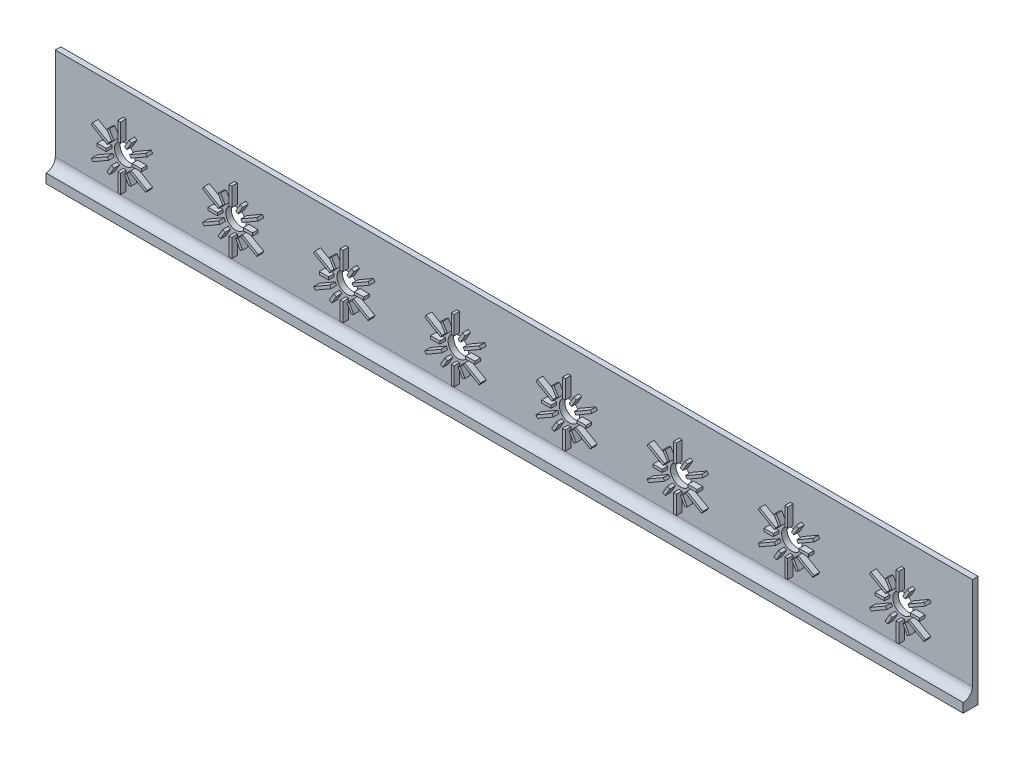
from build123d import *

# Parameters (mm, degrees)
SKETCH_1_W             = 495
SKETCH_1_H             = 60
EXTRUDE_1_DEPTH        = 3
SKETCH_2_R             = 5.5
CUT_EXTRUDE_1_DEPTH    = 499.632128929
PATTERN_LINEAR_1_COUNT = 8
PATTERN_LINEAR_1_PITCH = 60
SKETCH_3_W             = 495
SKETCH_3_H             = 5
EXTRUDE_2_DEPTH        = 5
FILLET_1_R             = 5
EXTRUDE_3_DEPTH        = 3
EXTRUDE_4_DEPTH        = 3
PATTERN_LINEAR_2_COUNT = 8
PATTERN_LINEAR_2_PITCH = 60


with BuildPart() as part:
    # 草图1 → 凸台-拉伸1 (new body)
    with BuildSketch(Plane.XY):
        with Locations((247.5, 30)):
            Rectangle(SKETCH_1_W, SKETCH_1_H)
    extrude(amount=EXTRUDE_1_DEPTH)

    # 草图2 → 切除-拉伸1 (cut, through all)
    with BuildSketch(Plane(origin=(0, 0, 0), x_dir=(-1, 0, 0), z_dir=(0, 0, -1))):
        with Locations((-37.5, 30)):
            Circle(SKETCH_2_R)
    cut_extrude_1 = extrude(amount=-CUT_EXTRUDE_1_DEPTH, mode=Mode.SUBTRACT)

    # 阵列(线性)1: 切除-拉伸1 ×8
    with Locations(*[(i * PATTERN_LINEAR_1_PITCH, 0, 0) for i in range(1, PATTERN_LINEAR_1_COUNT)]):
        add(cut_extrude_1, mode=Mode.SUBTRACT)

    # 草图3 → 凸台-拉伸2 (add)
    with BuildSketch(Plane.XY.offset(3)):
        with Locations((247.5, 2.5)):
            Rectangle(SKETCH_3_W, SKETCH_3_H)
    extrude(amount=EXTRUDE_2_DEPTH)

    # 圆角1
    fillet_1_edges = [part.edges().sort_by_distance(p)[0] for p in [
        (247.5, 5, 3),
    ]]
    fillet(fillet_1_edges, radius=FILLET_1_R - 0.0001)  # a hair under: the kernel refuses the full size

    # 草图4 → 凸台-拉伸3 (add)
    with BuildSketch(Plane.XY.offset(3)):
        with BuildLine():
            Line((43.152281726, 34.12937178), (51.812535763, 39.12937178))
            Line((51.812535763, 39.12937178), (52.562535763, 37.830333674))
            Line((52.562535763, 37.830333674), (43.902281726, 32.830333674))
            ThreePointArc((43.902281726, 32.830333674), (43.562177826, 33.5), (43.152281726, 34.12937178))
        make_face()
        with BuildLine():
            Line((36.75, 46.959705454), (38.25, 46.959705454))
            Line((38.25, 46.959705454), (38.25, 36.959705454))
            ThreePointArc((38.25, 36.959705454), (37.5, 37), (36.75, 36.959705454))
            Line((36.75, 36.959705454), (36.75, 46.959705454))
        make_face()
        with BuildLine():
            Line((43.902281726, 27.169666326), (52.562535763, 22.169666326))
            Line((52.562535763, 22.169666326), (51.812535763, 20.87062822))
            Line((51.812535763, 20.87062822), (43.152281726, 25.87062822))
            ThreePointArc((43.152281726, 25.87062822), (43.562177826, 26.5), (43.902281726, 27.169666326))
        make_face()
        with BuildLine():
            Line((38.25, 23.040294546), (38.25, 13.040294546))
            Line((38.25, 13.040294546), (36.75, 13.040294546))
            Line((36.75, 13.040294546), (36.75, 23.040294546))
            ThreePointArc((36.75, 23.040294546), (37.5, 23), (38.25, 23.040294546))
        make_face()
        with BuildLine():
            Line((31.847718274, 25.87062822), (23.187464237, 20.87062822))
            Line((23.187464237, 20.87062822), (22.437464237, 22.169666326))
            Line((22.437464237, 22.169666326), (31.097718274, 27.169666326))
            ThreePointArc((31.097718274, 27.169666326), (31.437822174, 26.5), (31.847718274, 25.87062822))
        make_face()
        with BuildLine():
            Line((31.097718274, 32.830333674), (22.437464237, 37.830333674))
            Line((22.437464237, 37.830333674), (23.187464237, 39.12937178))
            Line((23.187464237, 39.12937178), (31.847718274, 34.12937178))
            ThreePointArc((31.847718274, 34.12937178), (31.437822174, 33.5), (31.097718274, 32.830333674))
        make_face()
    extrude_3 = extrude(amount=EXTRUDE_3_DEPTH)

    # 草图5 → 凸台-拉伸4 (add)
    with BuildSketch(Plane.XY.offset(3)):
        with BuildLine():
            Line((42.830333674, 40.732408745), (40.330333674, 36.402281726))
            ThreePointArc((40.330333674, 36.402281726), (41, 36.062177826), (41.62937178, 35.652281726))
            Line((41.62937178, 35.652281726), (44.12937178, 39.982408745))
            Line((44.12937178, 39.982408745), (42.830333674, 40.732408745))
        make_face()
        with BuildLine():
            Line((49.459705454, 30.75), (44.459705454, 30.75))
            ThreePointArc((44.459705454, 30.75), (44.5, 30), (44.459705454, 29.25))
            Line((44.459705454, 29.25), (49.459705454, 29.25))
            Line((49.459705454, 29.25), (49.459705454, 30.75))
        make_face()
        with BuildLine():
            Line((44.12937178, 20.017591255), (41.62937178, 24.347718274))
            ThreePointArc((41.62937178, 24.347718274), (41, 23.937822174), (40.330333674, 23.597718274))
            Line((40.330333674, 23.597718274), (42.830333674, 19.267591255))
            Line((42.830333674, 19.267591255), (44.12937178, 20.017591255))
        make_face()
        with BuildLine():
            Line((32.169666326, 19.267591255), (34.669666326, 23.597718274))
            ThreePointArc((34.669666326, 23.597718274), (34, 23.937822174), (33.37062822, 24.347718274))
            Line((33.37062822, 24.347718274), (30.87062822, 20.017591255))
            Line((30.87062822, 20.017591255), (32.169666326, 19.267591255))
        make_face()
        with BuildLine():
            Line((25.540294546, 29.25), (30.540294546, 29.25))
            ThreePointArc((30.540294546, 29.25), (30.5, 30), (30.540294546, 30.75))
            Line((30.540294546, 30.75), (25.540294546, 30.75))
            Line((25.540294546, 30.75), (25.540294546, 29.25))
        make_face()
        with BuildLine():
            Line((30.87062822, 39.982408745), (33.37062822, 35.652281726))
            ThreePointArc((33.37062822, 35.652281726), (34, 36.062177826), (34.669666326, 36.402281726))
            Line((34.669666326, 36.402281726), (32.169666326, 40.732408745))
            Line((32.169666326, 40.732408745), (30.87062822, 39.982408745))
        make_face()
    extrude_4 = extrude(amount=EXTRUDE_4_DEPTH)

    # 阵列(线性)2: 凸台-拉伸3, 凸台-拉伸4 ×8
    with Locations(*[(i * PATTERN_LINEAR_2_PITCH, 0, 0) for i in range(1, PATTERN_LINEAR_2_COUNT)]):
        add(extrude_3)
        add(extrude_4)


solid = part.part
